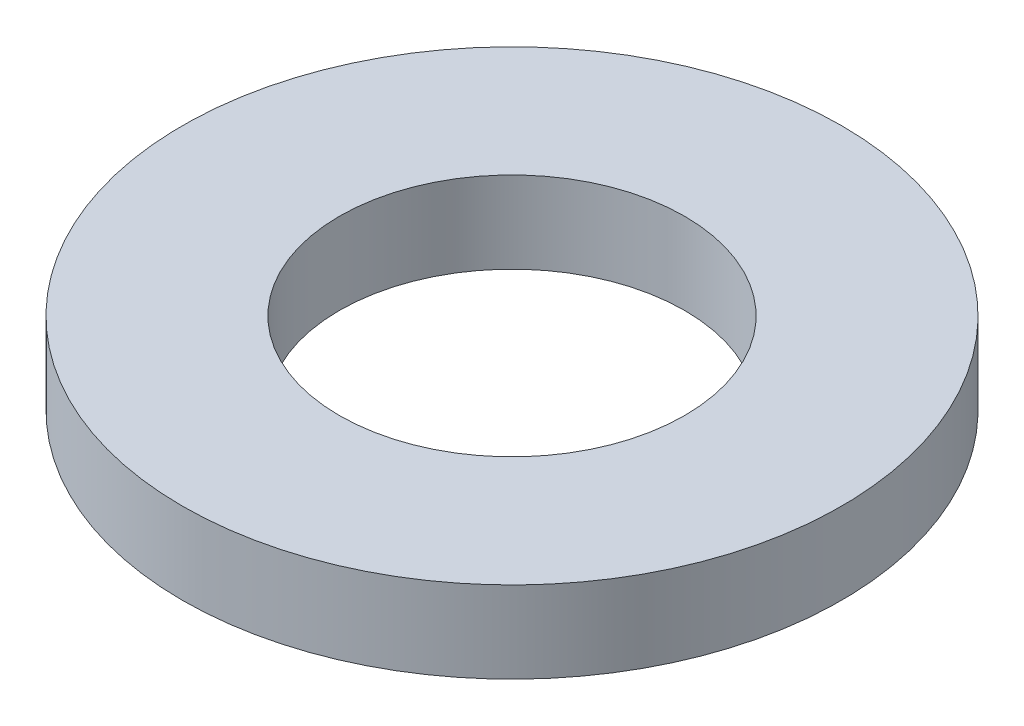
from build123d import *

# Parameters (mm, degrees)
SKETCH1_R           = 52.5
BOSS_EXTRUDE1_DEPTH = 13
SKETCH2_R           = 27.5
CUT_EXTRUDE1_DEPTH  = 76.375725535


with BuildPart() as part:
    # Sketch1 → Boss-Extrude1 (new body)
    with BuildSketch(Plane(origin=(0, 0, 0), x_dir=(1, 0, 0), z_dir=(0, 1, 0))):
        Circle(SKETCH1_R)
    extrude(amount=BOSS_EXTRUDE1_DEPTH)

    # Sketch2 → Cut-Extrude1 (cut, through all)
    with BuildSketch(Plane(origin=(0, 0, 0), x_dir=(1, 0, 0), z_dir=(0, 1, 0))):
        Circle(SKETCH2_R)
    extrude(amount=CUT_EXTRUDE1_DEPTH, mode=Mode.SUBTRACT)


solid = part.part
